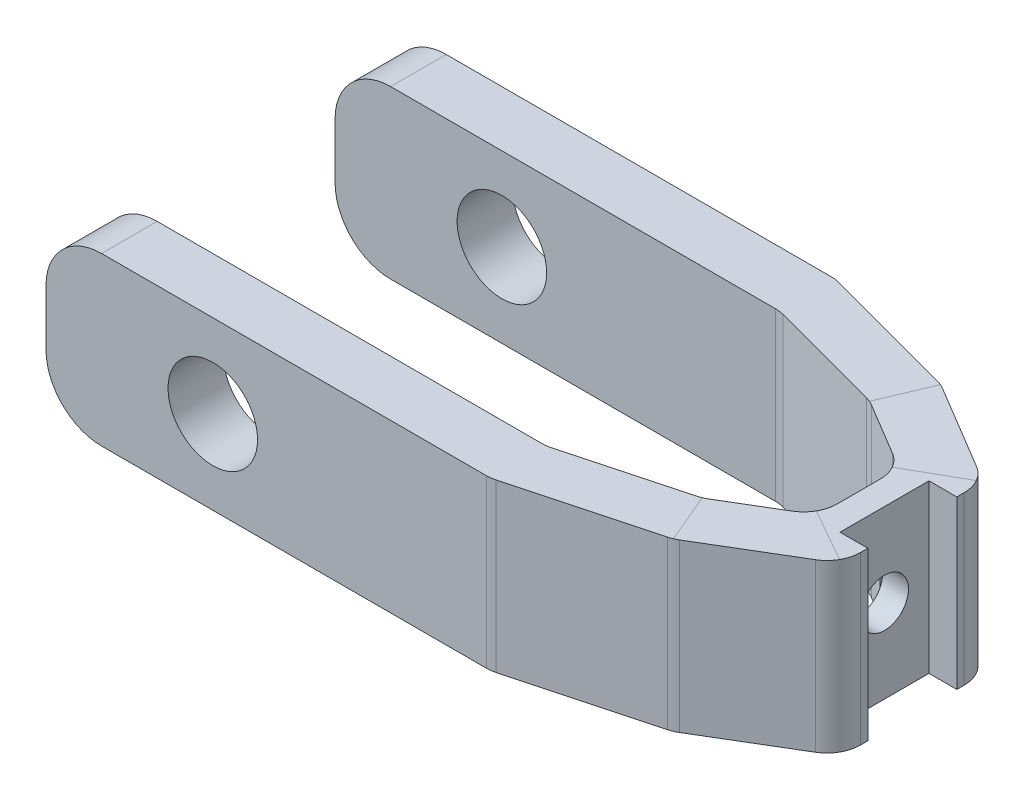
from build123d import *

# Parameters (mm, degrees)
SHAPE_BASE_R                   = 4.025
BOSS_EXTRUDE1_DEPTH            = 5
SWEEP2_START                   = -7.5
SWEEP2_DEPTH                   = 15
CUT_EXTRUDE2_REACH             = 52.965
BOSS_EXTRUDE2_DEPTH            = 15
CUT_EXTRUDE3_REACH             = 56.593
SKETCH4_10_R                   = 4.025
CUT_EXTRUDE3_DIRECTION_2_DEPTH = 55.593173935
FILLET1_R                      = 3
SKETCH21_W                     = 8
SKETCH21_H                     = 15
CUT_EXTRUDE4_DEPTH             = 2.5
F_6_CLEARANCE_HOLE1_D          = 4.3053
F_6_CLEARANCE_HOLE1_DEPTH      = 2.329629131


# Read off the part's stored shape, not the designer's step: Sweep2
with BuildPart() as part:
    # Shape - base → Boss-Extrude1 (new body)
    # profile 1 of 2: a face of its own
    with BuildSketch(Plane.XY):
        with BuildLine():
            Line((-10, 7.5), (25, 7.5))
            Line((25, 7.5), (25, -7.5))
            Line((25, -7.5), (-10, -7.5))
            ThreePointArc((-10, -7.5), (-13.535533906, -6.035533906), (-15, -2.5))
            Line((-15, -2.5), (-15, 2.5))
            ThreePointArc((-15, 2.5), (-13.535533906, 6.035533906), (-10, 7.5))
        make_face()
        Circle(SHAPE_BASE_R, mode=Mode.SUBTRACT)
    # profile 2 of 2: a face of its own
    with BuildSketch(Plane.XY):
        Circle(SHAPE_BASE_R)
    extrude(amount=-BOSS_EXTRUDE1_DEPTH)

    # Sweep2 outline → Sweep2 (add)
    with BuildSketch(Plane(origin=(0, 0, 0), x_dir=(1, 0, 0), z_dir=(0, 1, 0)).offset(SWEEP2_START)):
        Polygon((42.585185434, -6.869503049), (42.585185434, -11.147047613), (47.414814566, -9.852952387), (47.414814566, -4.130496951), (37.95038024, 1.529956073), (25, 5), (25, 0), (36.04961976, -2.960736691), align=None)
    extrude(amount=SWEEP2_DEPTH)

    # Sketch18 → Cut-Extrude2 (cut, up to next)
    with BuildSketch(Plane(origin=(0, 7.5, 0), x_dir=(1, 0, 0), z_dir=(0, 1, 0)), mode=Mode.PRIVATE) as cut_extrude2_sk1:
        Polygon((42.585185434, -11.147047613), (45, -10.5), (42.585185434, -10.5), align=None)
    cut_extrude2_tool1 = extrude(cut_extrude2_sk1.sketch, amount=-CUT_EXTRUDE2_REACH, mode=Mode.PRIVATE) & part.part
    add(cut_extrude2_tool1.solids().sort_by_distance((43.390124, 7.5, 10.715683))[0], mode=Mode.SUBTRACT)

    # Sketch18<3> → Boss-Extrude2 (add, through all)
    with BuildSketch(Plane(origin=(0, 7.5, 0), x_dir=(1, 0, 0), z_dir=(0, 1, 0))):
        Polygon((47.414814566, -10.5), (47.414814566, -9.852952387), (45, -10.5), align=None)
    extrude(amount=-BOSS_EXTRUDE2_DEPTH)

    # Mirror1: part across face


with BuildPart() as part_1:
    add(part.part)
    add(part.part.mirror(Plane(origin=(45, 0, 10.5), x_dir=(1, 0, 0), z_dir=(0, 0, 1))))

    # Sketch4<10> → Cut-Extrude3 (cut, up to next)
    with BuildSketch(Plane.XY, mode=Mode.PRIVATE) as cut_extrude3_sk1:
        with Locations(Location((0, 0, 0), (0, 0, 180))):
            Circle(SKETCH4_10_R)
    cut_extrude3_tool1 = extrude(cut_extrude3_sk1.sketch, amount=-CUT_EXTRUDE3_REACH, mode=Mode.PRIVATE) & part_1.part
    add(cut_extrude3_tool1.solids().sort_by_distance((0, 0, 0))[0], mode=Mode.SUBTRACT)

    # Sketch4<10> → Cut-Extrude3 direction 2 (cut)
    with BuildSketch(Plane.XY):
        with Locations(Location((0, 0, 0), (0, 0, 180))):
            Circle(SKETCH4_10_R)
    extrude(amount=CUT_EXTRUDE3_DIRECTION_2_DEPTH, mode=Mode.SUBTRACT)

    # Fillet1
    fillet1_edges = [part_1.edges().sort_by_distance(p)[0] for p in [
        (47.414814566, 0, 4.130496951),
        (42.585185434, 0, 6.869503049),
        (37.95038024, 0, -1.529956073),
        (36.04961976, 0, 2.960736691),
        (25, 0, -5),
        (25, 0, 0),
        (25, 0, 21),
        (42.585185434, 0, 14.130496951),
        (47.414814566, 0, 16.869503049),
        (37.95038024, 0, 22.529956073),
        (36.04961976, 0, 18.039263309),
        (25, 0, 26),
    ]]
    fillet(fillet1_edges, radius=FILLET1_R)

    # Sketch21 → Cut-Extrude4 (cut)
    with BuildSketch(Plane(origin=(47.414814566, 0, 0), x_dir=(0, 0, -1), z_dir=(1, 0, 0))):
        with Locations((-10.5, 0)):
            Rectangle(SKETCH21_W, SKETCH21_H)
    extrude(amount=-CUT_EXTRUDE4_DEPTH, mode=Mode.SUBTRACT)

    # #6 Clearance Hole1
    with Locations(Plane(origin=(44.914814566, 0, 0), x_dir=(0, 0, -1), z_dir=(1, 0, 0))):
        with Locations((-10.5, 0)):
            Hole(F_6_CLEARANCE_HOLE1_D / 2, depth=F_6_CLEARANCE_HOLE1_DEPTH)


solid = part_1.part
